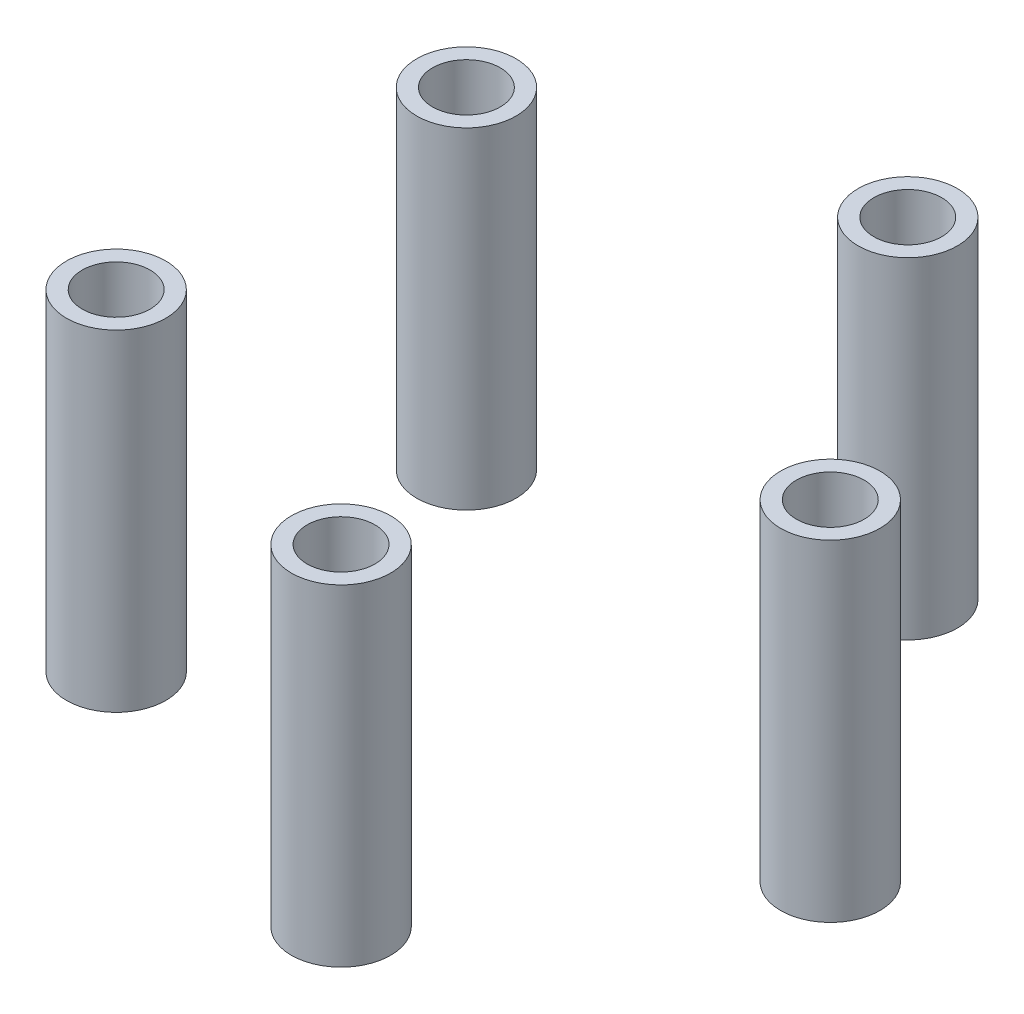
from build123d import *

# Parameters (mm, degrees)
BOSS_EXTRUDE1_DEPTH        = 10
BOSS_EXTRUDE1_DEPTH_BACK   = 10
SKETCH1_R                  = 3
SKETCH1_R_2                = 2.05
BOSS_EXTRUDE1_2_DEPTH      = 10
BOSS_EXTRUDE1_2_DEPTH_BACK = 10
BOSS_EXTRUDE1_3_DEPTH      = 10
BOSS_EXTRUDE1_3_DEPTH_BACK = 10
BOSS_EXTRUDE1_4_DEPTH      = 10
BOSS_EXTRUDE1_4_DEPTH_BACK = 10
BOSS_EXTRUDE1_5_DEPTH      = 10
BOSS_EXTRUDE1_5_DEPTH_BACK = 10


with BuildPart() as part:
    # Sketch1 → Boss-Extrude1 (new, two sides: drawn at the far end of the back side and taken through both)
    with BuildSketch(Plane(origin=(0, 0, 0), x_dir=(1, 0, 0), z_dir=(0, 1, 0)).offset(-BOSS_EXTRUDE1_DEPTH_BACK)):
        with Locations((-15.762305899, -10.580134541)):
            Circle(SKETCH1_R)
        with Locations((-15.762305899, -10.580134541)):
            Circle(SKETCH1_R_2, mode=Mode.SUBTRACT)
    extrude(amount=BOSS_EXTRUDE1_DEPTH + BOSS_EXTRUDE1_DEPTH_BACK)


with BuildPart() as body_2:
    # Sketch1 → Boss-Extrude1 2 (new, two sides: drawn at the far end of the back side and taken through both)
    with BuildSketch(Plane(origin=(0, 0, 0), x_dir=(1, 0, 0), z_dir=(0, 1, 0)).offset(-BOSS_EXTRUDE1_2_DEPTH_BACK)):
        with Locations((4.362305899, -17.119017293)):
            Circle(SKETCH1_R)
        with Locations((4.362305899, -17.119017293)):
            Circle(SKETCH1_R_2, mode=Mode.SUBTRACT)
    extrude(amount=BOSS_EXTRUDE1_2_DEPTH + BOSS_EXTRUDE1_2_DEPTH_BACK)


with BuildPart() as body_3:
    # Sketch1 → Boss-Extrude1 3 (new, two sides: drawn at the far end of the back side and taken through both)
    with BuildSketch(Plane(origin=(0, 0, 0), x_dir=(1, 0, 0), z_dir=(0, 1, 0)).offset(-BOSS_EXTRUDE1_3_DEPTH_BACK)):
        with Locations((16.8, 0)):
            Circle(SKETCH1_R)
        with Locations((16.8, 0)):
            Circle(SKETCH1_R_2, mode=Mode.SUBTRACT)
    extrude(amount=BOSS_EXTRUDE1_3_DEPTH + BOSS_EXTRUDE1_3_DEPTH_BACK)


with BuildPart() as body_4:
    # Sketch1 → Boss-Extrude1 4 (new, two sides: drawn at the far end of the back side and taken through both)
    with BuildSketch(Plane(origin=(0, 0, 0), x_dir=(1, 0, 0), z_dir=(0, 1, 0)).offset(-BOSS_EXTRUDE1_4_DEPTH_BACK)):
        with Locations((-15.762305899, 10.580134541)):
            Circle(SKETCH1_R)
        with Locations((-15.762305899, 10.580134541)):
            Circle(SKETCH1_R_2, mode=Mode.SUBTRACT)
    extrude(amount=BOSS_EXTRUDE1_4_DEPTH + BOSS_EXTRUDE1_4_DEPTH_BACK)


with BuildPart() as body_5:
    # Sketch1 → Boss-Extrude1 5 (new, two sides: drawn at the far end of the back side and taken through both)
    with BuildSketch(Plane(origin=(0, 0, 0), x_dir=(1, 0, 0), z_dir=(0, 1, 0)).offset(-BOSS_EXTRUDE1_5_DEPTH_BACK)):
        with Locations((4.362305899, 17.119017293)):
            Circle(SKETCH1_R)
        with Locations((4.362305899, 17.119017293)):
            Circle(SKETCH1_R_2, mode=Mode.SUBTRACT)
    extrude(amount=BOSS_EXTRUDE1_5_DEPTH + BOSS_EXTRUDE1_5_DEPTH_BACK)


solid = Compound([part.part, body_2.part, body_3.part, body_4.part, body_5.part])
